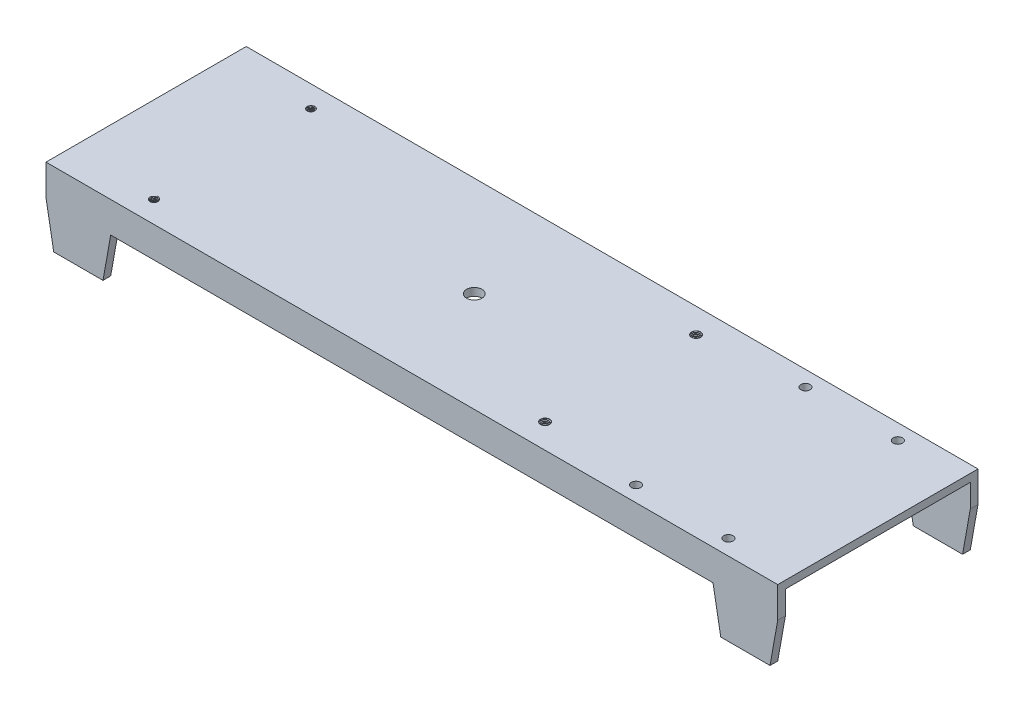
from build123d import *
from build123d.topology import SkipClean

# Parameters (mm, degrees)
BOSS_EXTRUDE1_DEPTH = 130
SKETCH4_W           = 120
SKETCH4_H           = 15
CUT_EXTRUDE3_DEPTH  = 495.801981
SKETCH6_W           = 120
SKETCH6_H           = 28
CUT_EXTRUDE4_DEPTH  = 250
SKETCH7_R           = 3
CUT_EXTRUDE5_DEPTH  = 275.973181
SKETCH8_R           = 3
SKETCH8_R_2         = 5
SKETCH8_R_3         = 2.5
CUT_EXTRUDE6_DEPTH  = 275.973181
THREAD1_PITCH       = 1
THREAD2_PITCH       = 1
THREAD3_PITCH       = 0.8
THREAD4_PITCH       = 0.8


with BuildPart() as part:
    # Sketch1 → Boss-Extrude1 (new body)
    with BuildSketch(Plane.XY):
        Polygon((-237.5, 0), (237.5, 0), (237.5, -20), (232.5, -48), (200.5, -48), (195.5, -20), (-195.5, -20), (-200.5, -48), (-232.5, -48), (-237.5, -20), align=None)
    extrude(amount=BOSS_EXTRUDE1_DEPTH)

    # Sketch4 → Cut-Extrude3 (cut, through all)
    with BuildSketch(Plane(origin=(237.5, 0, 0), x_dir=(0, 0, -1), z_dir=(1, 0, 0))):
        with Locations((-65, -12.5)):
            Rectangle(SKETCH4_W, SKETCH4_H)
    extrude(amount=-CUT_EXTRUDE3_DEPTH, mode=Mode.SUBTRACT)

    # Sketch6 → Cut-Extrude4 (cut, symmetric)
    with BuildSketch(Plane(origin=(0, 0, 0), x_dir=(0, 0, -1), z_dir=(1, 0, 0))):
        with Locations((-65, -34)):
            Rectangle(SKETCH6_W, SKETCH6_H)
    extrude(amount=CUT_EXTRUDE4_DEPTH, both=True, mode=Mode.SUBTRACT)

    # Sketch7 → Cut-Extrude5 (cut, through all)
    with BuildSketch(Plane(origin=(0, 0, 0), x_dir=(1, 0, 0), z_dir=(0, 1, 0))):
        with Locations(Location((135.5, -10, 0), (0, 0, 270))):
            Circle(SKETCH7_R)
        with Locations(Location((195.5, -10, 0), (0, 0, 270))):
            Circle(SKETCH7_R)
        with Locations(Location((195.5, -120, 0), (0, 0, 270))):
            Circle(SKETCH7_R)
        with Locations(Location((135.5, -120, 0), (0, 0, 270))):
            Circle(SKETCH7_R)
    extrude(amount=-CUT_EXTRUDE5_DEPTH, mode=Mode.SUBTRACT)

    # Sketch8 → Cut-Extrude6 (cut, through all)
    with BuildSketch(Plane(origin=(0, 0, 0), x_dir=(1, 0, 0), z_dir=(0, 1, 0))):
        with Locations(Location((70.5, -16, 0), (0, 0, 270))):
            Circle(SKETCH8_R)
        with Locations(Location((70.5, -114, 0), (0, 0, 270))):
            Circle(SKETCH8_R)
        with Locations(Location((-24.5, -65, 0), (0, 0, 270))):
            Circle(SKETCH8_R_2)
        with Locations(Location((-181.5, -14, 0), (0, 0, 270))):
            Circle(SKETCH8_R_3)
        with Locations(Location((-181.5, -116, 0), (0, 0, 270))):
            Circle(SKETCH8_R_3)
    extrude(amount=-CUT_EXTRUDE6_DEPTH, mode=Mode.SUBTRACT)

    # Thread1: the profile of Thread Profile1 profile screwed along a right-hand helix of 5 turns, 8 arcs to a turn; built about Z, then put on its axis
    with SkipClean():  # the faces are left unmerged after this step: merging them gives an invalid solid
        thread1_z = Axis((0, 0, 0), (0, 0, 1))
        thread1_corners = [(3.0003, 0, -0.000173), (3.0003, 0, 0.875173), (2.458734, 0, 0.5625), (2.458734, 0, 0.3125)]
        with BuildLine(mode=Mode.PRIVATE) as thread1_profile:
            Line(thread1_corners[0], thread1_corners[1])
            Line(thread1_corners[1], thread1_corners[2])
            Line(thread1_corners[2], thread1_corners[3])
            Line(thread1_corners[3], thread1_corners[0])
        thread1_cap = Face(thread1_profile.wire())
        thread1_turn_angles = [0, 22.5, 45, 67.5, 90, 112.5, 135, 157.5, 180, 202.5, 225, 247.5, 270, 292.5, 315, 337.5, 360]
        thread1_turn_weights = [1, 0.9238795325112867, 1, 0.9238795325112867, 1, 0.9238795325112867, 1, 0.9238795325112867, 1, 0.9238795325112867, 1, 0.9238795325112867, 1, 0.9238795325112867, 1, 0.9238795325112867, 1]
        thread1_turn_rails = [Edge.make_bspline([Vector(p[0], p[1], 0).rotate(thread1_z, thread1_turn_angles[k]) / thread1_turn_weights[k] + Vector(0, 0, p[2] + THREAD1_PITCH * thread1_turn_angles[k] / 360) for k in range(17)], [0, 0, 0, 1, 1, 2, 2, 3, 3, 4, 4, 5, 5, 6, 6, 7, 7, 8, 8, 8], 2, thread1_turn_weights) for p in thread1_corners]
        thread1_turn_sides = [Face.make_surface_from_curves(thread1_turn_rails[p[0]], thread1_turn_rails[p[1]]) for p in [(0, 1), (1, 2), (2, 3), (3, 0)]]
        thread1 = Plane(origin=(70.5, 0, 114), x_dir=(-1, 0, 0), z_dir=(0, -1, 0)) * Solid(Shell([*[p.moved(Location((0, 0, THREAD1_PITCH * i))) for i in range(5) for p in thread1_turn_sides], thread1_cap, thread1_cap.rotate(thread1_z, 1800).moved(Location((0, 0, THREAD1_PITCH * 1800 / 360)))]))
        add(thread1)

    # Thread2: the profile of Thread Profile2 profile screwed along a right-hand helix of 5 turns, 8 arcs to a turn; built about Z, then put on its axis
    with SkipClean():  # the faces are left unmerged after this step: merging them gives an invalid solid
        thread2_z = Axis((0, 0, 0), (0, 0, 1))
        thread2_corners = [(3.0003, 0, -0.000173), (3.0003, 0, 0.875173), (2.458734, 0, 0.5625), (2.458734, 0, 0.3125)]
        with BuildLine(mode=Mode.PRIVATE) as thread2_profile:
            Line(thread2_corners[0], thread2_corners[1])
            Line(thread2_corners[1], thread2_corners[2])
            Line(thread2_corners[2], thread2_corners[3])
            Line(thread2_corners[3], thread2_corners[0])
        thread2_cap = Face(thread2_profile.wire())
        thread2_turn_angles = [0, 22.5, 45, 67.5, 90, 112.5, 135, 157.5, 180, 202.5, 225, 247.5, 270, 292.5, 315, 337.5, 360]
        thread2_turn_weights = [1, 0.9238795325112867, 1, 0.9238795325112867, 1, 0.9238795325112867, 1, 0.9238795325112867, 1, 0.9238795325112867, 1, 0.9238795325112867, 1, 0.9238795325112867, 1, 0.9238795325112867, 1]
        thread2_turn_rails = [Edge.make_bspline([Vector(p[0], p[1], 0).rotate(thread2_z, thread2_turn_angles[k]) / thread2_turn_weights[k] + Vector(0, 0, p[2] + THREAD2_PITCH * thread2_turn_angles[k] / 360) for k in range(17)], [0, 0, 0, 1, 1, 2, 2, 3, 3, 4, 4, 5, 5, 6, 6, 7, 7, 8, 8, 8], 2, thread2_turn_weights) for p in thread2_corners]
        thread2_turn_sides = [Face.make_surface_from_curves(thread2_turn_rails[p[0]], thread2_turn_rails[p[1]]) for p in [(0, 1), (1, 2), (2, 3), (3, 0)]]
        thread2 = Plane(origin=(70.5, 0, 16), x_dir=(-1, 0, 0), z_dir=(0, -1, 0)) * Solid(Shell([*[p.moved(Location((0, 0, THREAD2_PITCH * i))) for i in range(5) for p in thread2_turn_sides], thread2_cap, thread2_cap.rotate(thread2_z, 1800).moved(Location((0, 0, THREAD2_PITCH * 1800 / 360)))]))
        add(thread2)

    # Thread3: the profile of Thread Profile3 profile screwed along a right-hand helix of 6.25 turns, 8 arcs to a turn; built about Z, then put on its axis
    with SkipClean():  # the faces are left unmerged after this step: merging them gives an invalid solid
        thread3_z = Axis((0, 0, 0), (0, 0, 1))
        thread3_corners = [(2.5003, 0, -0.000173), (2.5003, 0, 0.700173), (2.066987, 0, 0.45), (2.066987, 0, 0.25)]
        with BuildLine(mode=Mode.PRIVATE) as thread3_profile:
            Line(thread3_corners[0], thread3_corners[1])
            Line(thread3_corners[1], thread3_corners[2])
            Line(thread3_corners[2], thread3_corners[3])
            Line(thread3_corners[3], thread3_corners[0])
        thread3_cap = Face(thread3_profile.wire())
        thread3_turn_angles = [0, 22.5, 45, 67.5, 90, 112.5, 135, 157.5, 180, 202.5, 225, 247.5, 270, 292.5, 315, 337.5, 360]
        thread3_turn_weights = [1, 0.9238795325112867, 1, 0.9238795325112867, 1, 0.9238795325112867, 1, 0.9238795325112867, 1, 0.9238795325112867, 1, 0.9238795325112867, 1, 0.9238795325112867, 1, 0.9238795325112867, 1]
        thread3_turn_rails = [Edge.make_bspline([Vector(p[0], p[1], 0).rotate(thread3_z, thread3_turn_angles[k]) / thread3_turn_weights[k] + Vector(0, 0, p[2] + THREAD3_PITCH * thread3_turn_angles[k] / 360) for k in range(17)], [0, 0, 0, 1, 1, 2, 2, 3, 3, 4, 4, 5, 5, 6, 6, 7, 7, 8, 8, 8], 2, thread3_turn_weights) for p in thread3_corners]
        thread3_turn_sides = [Face.make_surface_from_curves(thread3_turn_rails[p[0]], thread3_turn_rails[p[1]]) for p in [(0, 1), (1, 2), (2, 3), (3, 0)]]
        thread3_last_angles = [2160, 2182.5, 2205, 2227.5, 2250]
        thread3_last_weights = [1, 0.9238795325112867, 1, 0.9238795325112913, 1]
        thread3_last_rails = [Edge.make_bspline([Vector(p[0], p[1], 0).rotate(thread3_z, thread3_last_angles[k]) / thread3_last_weights[k] + Vector(0, 0, p[2] + THREAD3_PITCH * thread3_last_angles[k] / 360) for k in range(5)], [0, 0, 0, 1, 1, 2, 2, 2], 2, thread3_last_weights) for p in thread3_corners]
        thread3_last_sides = [Face.make_surface_from_curves(thread3_last_rails[p[0]], thread3_last_rails[p[1]]) for p in [(0, 1), (1, 2), (2, 3), (3, 0)]]
        thread3 = Plane(origin=(-181.5, 0, 14), x_dir=(-1, 0, 0), z_dir=(0, -1, 0)) * Solid(Shell([*[p.moved(Location((0, 0, THREAD3_PITCH * i))) for i in range(6) for p in thread3_turn_sides], *thread3_last_sides, thread3_cap, thread3_cap.rotate(thread3_z, 2250).moved(Location((0, 0, THREAD3_PITCH * 2250 / 360)))]))
        add(thread3)

    # Thread4: the profile of Thread Profile4 profile screwed along a right-hand helix of 6.25 turns, 8 arcs to a turn; built about Z, then put on its axis
    thread4_z = Axis((0, 0, 0), (0, 0, 1))
    thread4_corners = [(2.5003, 0, -0.000173), (2.5003, 0, 0.700173), (2.066987, 0, 0.45), (2.066987, 0, 0.25)]
    with BuildLine(mode=Mode.PRIVATE) as thread4_profile:
        Line(thread4_corners[0], thread4_corners[1])
        Line(thread4_corners[1], thread4_corners[2])
        Line(thread4_corners[2], thread4_corners[3])
        Line(thread4_corners[3], thread4_corners[0])
    thread4_cap = Face(thread4_profile.wire())
    thread4_turn_angles = [0, 22.5, 45, 67.5, 90, 112.5, 135, 157.5, 180, 202.5, 225, 247.5, 270, 292.5, 315, 337.5, 360]
    thread4_turn_weights = [1, 0.9238795325112867, 1, 0.9238795325112867, 1, 0.9238795325112867, 1, 0.9238795325112867, 1, 0.9238795325112867, 1, 0.9238795325112867, 1, 0.9238795325112867, 1, 0.9238795325112867, 1]
    thread4_turn_rails = [Edge.make_bspline([Vector(p[0], p[1], 0).rotate(thread4_z, thread4_turn_angles[k]) / thread4_turn_weights[k] + Vector(0, 0, p[2] + THREAD4_PITCH * thread4_turn_angles[k] / 360) for k in range(17)], [0, 0, 0, 1, 1, 2, 2, 3, 3, 4, 4, 5, 5, 6, 6, 7, 7, 8, 8, 8], 2, thread4_turn_weights) for p in thread4_corners]
    thread4_turn_sides = [Face.make_surface_from_curves(thread4_turn_rails[p[0]], thread4_turn_rails[p[1]]) for p in [(0, 1), (1, 2), (2, 3), (3, 0)]]
    thread4_last_angles = [2160, 2182.5, 2205, 2227.5, 2250]
    thread4_last_weights = [1, 0.9238795325112867, 1, 0.9238795325112913, 1]
    thread4_last_rails = [Edge.make_bspline([Vector(p[0], p[1], 0).rotate(thread4_z, thread4_last_angles[k]) / thread4_last_weights[k] + Vector(0, 0, p[2] + THREAD4_PITCH * thread4_last_angles[k] / 360) for k in range(5)], [0, 0, 0, 1, 1, 2, 2, 2], 2, thread4_last_weights) for p in thread4_corners]
    thread4_last_sides = [Face.make_surface_from_curves(thread4_last_rails[p[0]], thread4_last_rails[p[1]]) for p in [(0, 1), (1, 2), (2, 3), (3, 0)]]
    thread4 = Plane(origin=(-181.5, -5, 116), x_dir=(1, 0, 0), z_dir=(0, 1, 0)) * Solid(Shell([*[p.moved(Location((0, 0, THREAD4_PITCH * i))) for i in range(6) for p in thread4_turn_sides], *thread4_last_sides, thread4_cap, thread4_cap.rotate(thread4_z, 2250).moved(Location((0, 0, THREAD4_PITCH * 2250 / 360)))]))
    add(thread4)


solid = part.part
